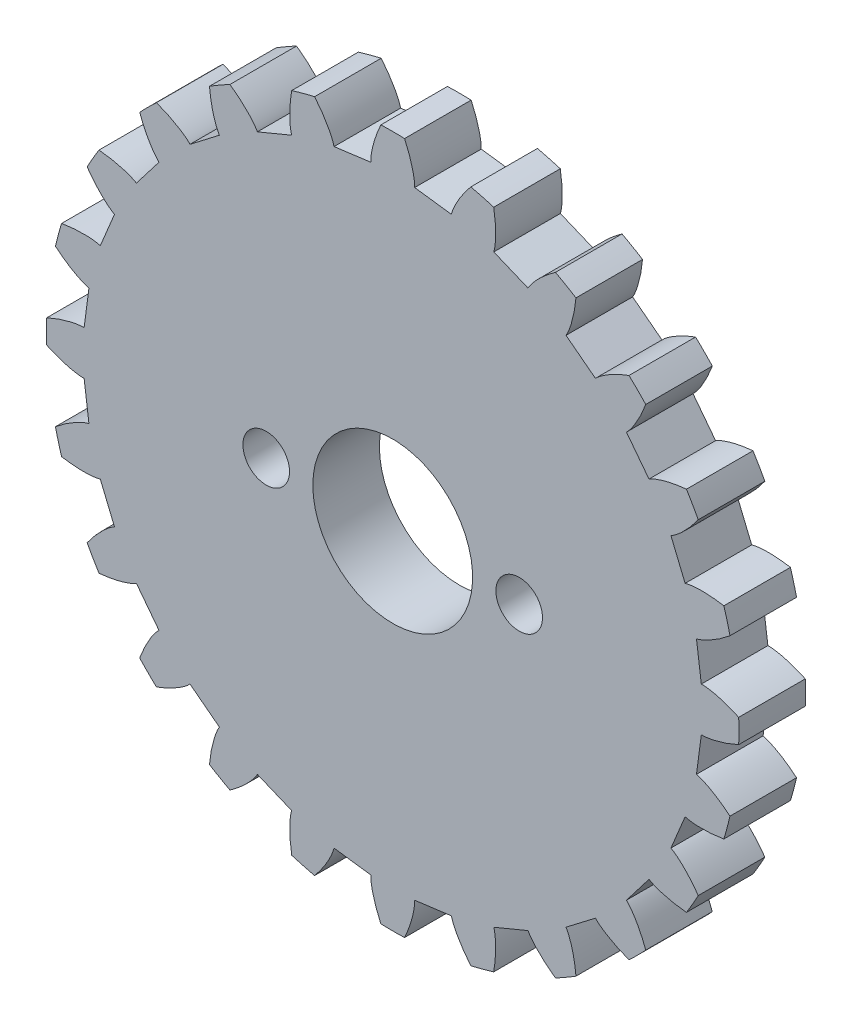
from build123d import *

# Parameters (mm, degrees)
SKETCH1_W               = 26
SKETCH1_H               = 5
CUT_EXTRUDE2_DEPTH      = 6
CIRPATTERN1_COUNT       = 24
CUT_EXTRUDE4_DEPTH      = 7
CUT_EXTRUDE4_DEPTH_BACK = 7
SKETCH3_R               = 6
SKETCH3_R_2             = 1.75


with BuildPart() as part:
    # Sketch1 → Revolve1 (revolve)
    with BuildSketch(Plane(origin=(0, 0, 0), x_dir=(1, 0, 0), z_dir=(0, 1, 0))):
        with Locations((13, -2.5)):
            Rectangle(SKETCH1_W, SKETCH1_H)
    revolve(axis=Axis((0, 0, 1), (0, 0, 1)))

    # Sketch2 → Cut-Extrude2 (cut, symmetric)
    with BuildSketch(Plane.XY):
        with BuildLine():
            add(Edge.make_bspline(
                [(23.177011452, 1.648214839), (23.181334508, 1.648476152), (23.193469167, 1.649066898), (23.21644737, 1.649622191), (23.253990407, 1.649730291), (23.301893166, 1.648694511), (23.363877463, 1.646007435), (23.436976629, 1.641106961), (23.517385457, 1.633902808), (23.604936789, 1.624101126), (23.692334914, 1.612585168), (23.779559647, 1.599479511), (23.866480028, 1.584964537), (23.97179544, 1.565656387), (24.098109724, 1.540104733), (24.245772691, 1.506741047), (24.413250584, 1.464772789), (24.583915466, 1.417582652), (24.751819259, 1.367517322), (24.921399292, 1.312757179), (25.085429511, 1.256815406), (25.255708411, 1.19442981), (25.412835504, 1.134668966), (25.588734702, 1.062978326), (25.730647904, 1.003740753), (25.877106617, 0.938597761), (25.948367996, 0.906309242), (25.984777755, 0.889562166)],
                knots=[4.9e-08, 4.9e-08, 4.9e-08, 4.9e-08, 4.9e-08, 0.005376749, 0.015083688, 0.02853182, 0.04661014, 0.064854849, 0.092110526, 0.119476176, 0.146842496, 0.174208854, 0.201574956, 0.228941013, 0.256307345, 0.307035032, 0.361767352, 0.416499661, 0.471231937, 0.525964282, 0.580696616, 0.635428982, 0.690161387, 0.744893688, 0.799626082, 0.854358407, 0.909090945, 0.909090945, 0.909090945, 0.909090945, 0.909090945], degree=4))
            add(Edge.make_bspline(
                [(25.984777755, 0.889562166), (26.326337644, 0.901255077), (27.022297624, 0.925080551), (28.753438041, 0.984344362), (30.156496922, 1.032376639), (32.175730812, 1.101503033), (33.880296874, 1.159857098), (35.848494254, 1.22723631), (37.694657729, 1.290437817), (39.650617192, 1.357398076), (41.531074843, 1.421773609), (43.432052562, 1.486851625), (45.27081659, 1.549799819), (47.012870983, 1.609437258), (48.716308198, 1.667752678), (50.22847828, 1.719520265), (51.638447234, 1.767789101), (52.961301877, 1.813075668), (54.260530168, 1.857553412), (55.450552976, 1.898292618), (56.867671345, 1.946806207), (57.895610662, 1.981996652), (59.165556981, 2.025471957), (59.698554144, 2.043718567), (59.964752001, 2.052831576)],
                knots=[0.083333333, 0.083333333, 0.083333333, 0.083333333, 0.083333333, 0.123540522, 0.166752518, 0.20939217, 0.256181319, 0.300394918, 0.346611722, 0.394831731, 0.442050137, 0.489268544, 0.532909799, 0.580271291, 0.622910943, 0.660113324, 0.699652778, 0.729462378, 0.759701236, 0.792420253, 0.822587569, 0.854042659, 0.885330815, 0.916666667, 0.916666667, 0.916666667, 0.916666667, 0.916666667], degree=4))
            add(Edge.make_bspline(
                [(59.964752001, 2.052831576), (59.960814186, 2.167858114), (59.952297358, 2.391864205), (59.929164639, 2.956118344), (59.904214054, 3.387496151), (59.867605218, 4.011105795), (59.829864935, 4.51860188), (59.784692875, 5.095593464), (59.735840758, 5.630008668), (59.681149933, 6.189197163), (59.621758447, 6.733032502), (59.557276862, 7.284499224), (59.487467195, 7.831673622), (59.413279, 8.378271577), (59.332833338, 8.927636588), (59.249446165, 9.468312835), (59.157544813, 10.022602471), (59.066415503, 10.551451777), (58.960711951, 11.120474239), (58.865816613, 11.620445718), (58.739775981, 12.232281443), (58.652227604, 12.655418094), (58.528532377, 13.206432928), (58.478781958, 13.425010514), (58.452814537, 13.537136799)],
                knots=[0.083333333, 0.083333333, 0.083333333, 0.083333333, 0.083333333, 0.123015873, 0.162698413, 0.202380952, 0.242063492, 0.281746032, 0.321428571, 0.361111111, 0.400793651, 0.44047619, 0.48015873, 0.51984127, 0.55952381, 0.599206349, 0.638888889, 0.678571429, 0.718253968, 0.757936508, 0.797619048, 0.837301587, 0.876984127, 0.916666667, 0.916666667, 0.916666667, 0.916666667, 0.916666667], degree=4))
            add(Edge.make_bspline(
                [(58.452814537, 13.537136799), (58.20964739, 13.480821513), (57.763573408, 13.377514862), (56.725391472, 13.137081428), (55.8234494, 12.9281999), (54.568002695, 12.637449934), (53.442908126, 12.37688833), (52.051066759, 12.054550609), (50.599185378, 11.71830817), (49.050388981, 11.359621101), (47.456325392, 10.990450564), (45.863179114, 10.621492469), (44.310239505, 10.261845869), (42.761818753, 9.903245796), (41.19068425, 9.539385426), (39.606325736, 9.172462496), (38.04283385, 8.810372086), (36.384968272, 8.426425592), (34.823246198, 8.064745055), (33.059291031, 7.656229184), (31.526671947, 7.301288632), (29.630406056, 6.862130808), (28.296636624, 6.553242016), (26.46186913, 6.128326658), (25.742799277, 5.961796662), (25.329603628, 5.866104331)],
                knots=[0.083333333, 0.083333333, 0.083333333, 0.083333333, 0.083333333, 0.112698499, 0.136843192, 0.163042686, 0.191354652, 0.22865676, 0.25743007, 0.29840472, 0.340289918, 0.382675918, 0.419052302, 0.457932692, 0.497207653, 0.537818085, 0.578079473, 0.616034139, 0.656644571, 0.701140006, 0.741113054, 0.783999854, 0.826385854, 0.866768648, 0.916666667, 0.916666667, 0.916666667, 0.916666667, 0.916666667], degree=4))
            add(Edge.make_bspline(
                [(22.813863401, 4.406598729), (22.818106786, 4.407465209), (22.829980863, 4.410035274), (22.852319823, 4.415446098), (22.88861159, 4.425058535), (22.934614023, 4.438457167), (22.993790789, 4.457095399), (23.063130826, 4.48074835), (23.138935217, 4.508518364), (23.220966449, 4.540646014), (23.302406005, 4.574389875), (23.383266634, 4.60962439), (23.463468523, 4.646141428), (23.560198082, 4.692049302), (23.675595057, 4.749422847), (23.809591373, 4.819867681), (23.960500411, 4.903752374), (24.113136321, 4.993505868), (24.26236107, 5.085321962), (24.411989837, 5.182106741), (24.555952065, 5.278596488), (24.704282272, 5.382927769), (24.840588144, 5.481319796), (24.991938819, 5.596093699), (25.113684634, 5.690042641), (25.238292641, 5.790872243), (25.298768964, 5.840504359), (25.329603628, 5.866104331)],
                knots=[0, 0, 0, 0, 0, 0.005376749, 0.015083688, 0.02853182, 0.04661014, 0.064854849, 0.092110526, 0.119476176, 0.146842496, 0.174208854, 0.201574956, 0.228941013, 0.256307345, 0.307035032, 0.361767352, 0.416499661, 0.471231937, 0.525964282, 0.580696616, 0.635428982, 0.690161387, 0.744893688, 0.799626082, 0.854358407, 0.909090914, 0.909090914, 0.909090914, 0.909090914, 0.909090914], degree=4))
            add(Edge.make_bspline(
                [(22.813863401, 4.406598729), (22.817584815, 4.378331786), (22.824435682, 4.326294289), (22.843127325, 4.184317157), (22.856700715, 4.081217025), (22.877221208, 3.925348406), (22.893988729, 3.79798644), (22.912784591, 3.655217697), (22.929847095, 3.525615107), (22.94758374, 3.390891914), (22.963787833, 3.267809614), (22.980920206, 3.137676314), (22.998141151, 3.006870255), (23.01614685, 2.870103392), (23.034495263, 2.730733359), (23.053237156, 2.588374548), (23.071092368, 2.452750745), (23.090657146, 2.3041415), (23.107541818, 2.175889682), (23.129513893, 2.008995205), (23.144430986, 1.895688635), (23.164837088, 1.740688902), (23.172880923, 1.679589913), (23.177011452, 1.648214839)],
                knots=[0.083333333, 0.083333333, 0.083333333, 0.083333333, 0.083333333, 0.124323918, 0.163161058, 0.206805889, 0.246995192, 0.28891226, 0.331780849, 0.370108841, 0.409254808, 0.448242187, 0.482805823, 0.525716146, 0.568843483, 0.611703726, 0.653695913, 0.694185697, 0.738247863, 0.782176482, 0.823818109, 0.87116887, 0.916666667, 0.916666667, 0.916666667, 0.916666667, 0.916666667], degree=4))
        make_face()
    cut_extrude2 = extrude(amount=CUT_EXTRUDE2_DEPTH, both=True, mode=Mode.SUBTRACT)

    # CirPattern1: Cut-Extrude2 ×24 about axis
    cirpattern1_axis = Axis((0, 0, -0.25), (0, 0, 1))
    for i in range(1, CIRPATTERN1_COUNT):
        add(cut_extrude2.rotate(cirpattern1_axis, i * 360 / CIRPATTERN1_COUNT), mode=Mode.SUBTRACT)

    # Sketch3 → Cut-Extrude4 (cut, two sides: drawn at the far end of the back side and taken through both)
    with BuildSketch(Plane.XY.offset(-CUT_EXTRUDE4_DEPTH_BACK)):
        Circle(SKETCH3_R)
        with Locations((9.5, 0)):
            Circle(SKETCH3_R_2)
        with Locations((-9.5, 0)):
            Circle(SKETCH3_R_2)
    extrude(amount=CUT_EXTRUDE4_DEPTH + CUT_EXTRUDE4_DEPTH_BACK, mode=Mode.SUBTRACT)


solid = part.part
